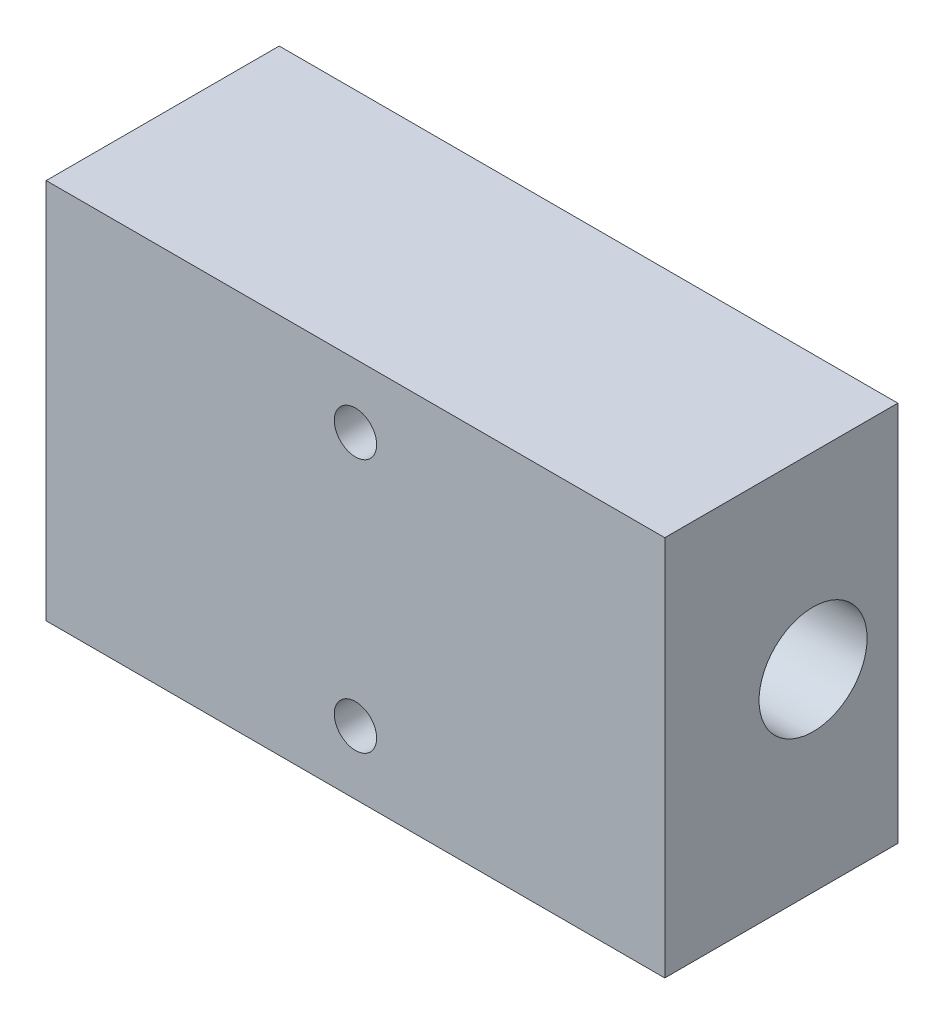
from build123d import *

# Parameters (mm, degrees)
CROQUIS1_W                         = 58.4
CROQUIS1_H                         = 36
SALIENTE_EXTRUIR1_DEPTH            = 22
CROQUIS2_R                         = 5.1
CORTAR_EXTRUIR1_DEPTH              = 73.045541153
TALADROS_DE_ESPIGA_DE_4_0MM2_D     = 4
TALADROS_DE_ESPIGA_DE_4_0MM2_DEPTH = 12
TALADROS_DE_ESPIGA_DE_4_0MM2_TIP   = 1.201721238


with BuildPart() as part:
    # Croquis1 → Saliente-Extruir1 (new body)
    with BuildSketch(Plane.XY):
        with Locations((29.2, 18)):
            Rectangle(CROQUIS1_W, CROQUIS1_H)
    extrude(amount=SALIENTE_EXTRUIR1_DEPTH)

    # Croquis2 → Cortar-Extruir1 (cut, through all)
    with BuildSketch(Plane(origin=(58.4, 0, 0), x_dir=(0, 0, -1), z_dir=(1, 0, 0))):
        with Locations((-8, 18.236268226)):
            Circle(CROQUIS2_R)
    extrude(amount=-CORTAR_EXTRUIR1_DEPTH, mode=Mode.SUBTRACT)

    # Taladros de espiga de Ø4.0mm2
    with Locations(Plane.XY.offset(22)):
        with Locations((29.2, 6), (29.2, 30)):
            Hole(TALADROS_DE_ESPIGA_DE_4_0MM2_D / 2, depth=TALADROS_DE_ESPIGA_DE_4_0MM2_DEPTH)
            with Locations((0, 0, -(TALADROS_DE_ESPIGA_DE_4_0MM2_DEPTH + TALADROS_DE_ESPIGA_DE_4_0MM2_TIP / 2))):  # 118° drill point
                Cone(0, TALADROS_DE_ESPIGA_DE_4_0MM2_D / 2, TALADROS_DE_ESPIGA_DE_4_0MM2_TIP, mode=Mode.SUBTRACT)


solid = part.part
